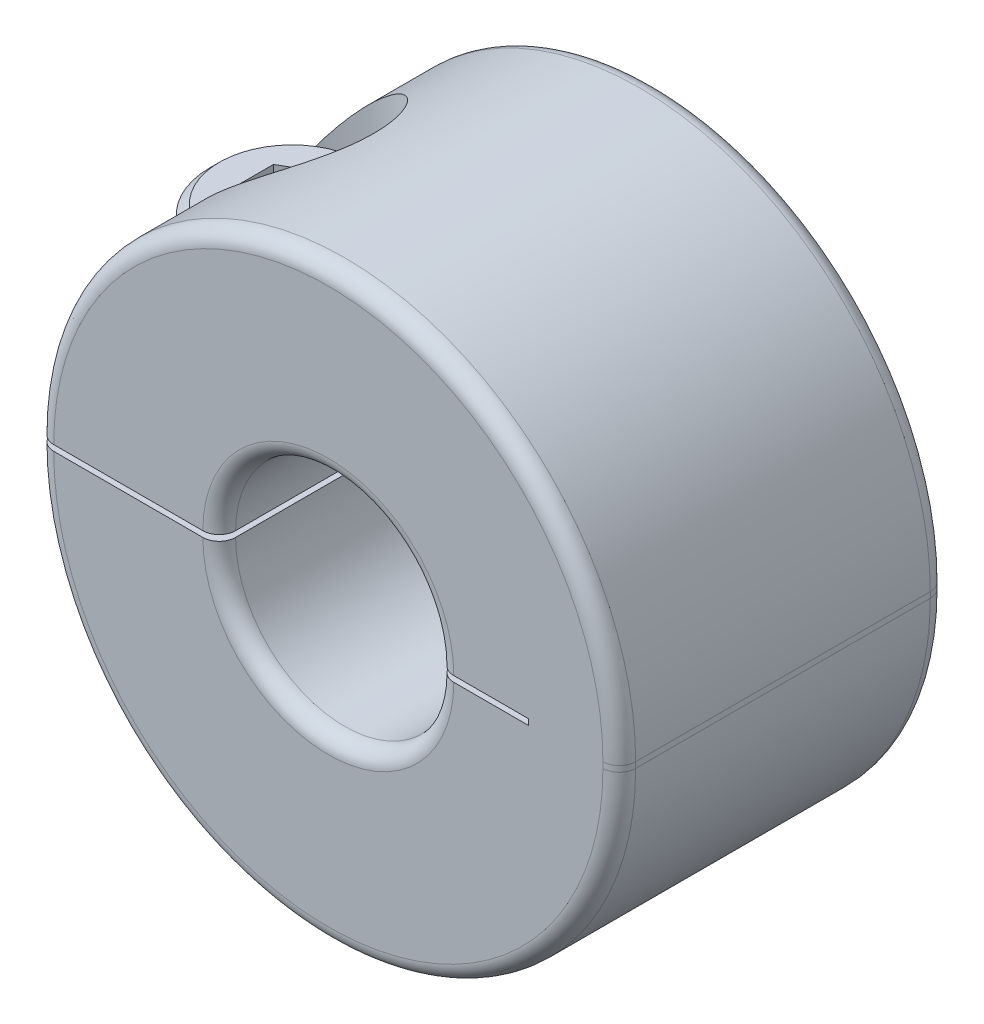
from build123d import *

# Parameters (mm, degrees)
EXTRUDE1_DEPTH     = 4.5
CUT_EXTRUDE2_DEPTH = 1.5
FILLET1_R          = 0.45
FILLET2_R          = 0.45
CHAMFER2_SIZE      = 0.254


with BuildPart() as part:
    # Sketch1 → Extrude1 (new, symmetric)
    with BuildSketch(Plane.XY):
        with BuildLine():
            Line((-8, 0.08), (-3, 0.08))
            ThreePointArc((-3, 0.08), (0, 3.08), (3, 0.08))
            Line((3, 0.08), (5.5, 0.08))
            Line((5.5, 0.08), (5.5, -0.08))
            Line((5.5, -0.08), (3, -0.08))
            ThreePointArc((3, -0.08), (0, -3.08), (-3, -0.08))
            Line((-3, -0.08), (-8, -0.08))
            ThreePointArc((-8, -0.08), (0, -8.08), (8, -0.08))
            Line((8, -0.08), (8, 0.08))
            ThreePointArc((8, 0.08), (0, 8.08), (-8, 0.08))
        make_face()
    extrude(amount=EXTRUDE1_DEPTH, both=True)

    # Sketch4 → Cut-Revolve1 (revolve, cut)
    with BuildSketch(Plane.XY):
        Polygon((-5.5, 8.08), (-3.25, 8.08), (-3.25, 1.58), (-4, 1.58), (-4, -8.08), (-5.5, -8.08), align=None)
    revolve(axis=Axis((-5.5, -8.08, 0), (0, 1, 0)), mode=Mode.SUBTRACT)

    # Fillet1
    fillet1_edges = [part.edges().sort_by_distance(p)[0] for p in [
        (0, 3.08, -4.5),
        (0, 3.08, 4.5),
        (0, 8.08, -4.5),
        (0, 8.08, 4.5),
        (0, -8.08, -4.5),
        (0, -8.08, 4.5),
        (8, 0, -4.5),
        (8, 0, 4.5),
    ]]
    fillet(fillet1_edges, radius=FILLET1_R)

    # Fillet2
    fillet2_edges = [part.edges().sort_by_distance(p)[0] for p in [
        (0, -3.08, -4.5),
        (0, -3.08, 4.5),
    ]]
    fillet(fillet2_edges, radius=FILLET2_R)


with BuildPart() as body_2:
    # Sketch6 → Revolve1 (revolve)
    with BuildSketch(Plane.XY):
        Polygon((-5.5, 4.58), (-3.25, 4.58), (-3.25, 1.58), (-4, 1.58), (-4, -4.42), (-5.5, -4.42), align=None)
    revolve(axis=Axis((-5.5, -4.42, 0), (0, 1, 0)))

    # Sketch7 → Cut-Extrude2 (cut)
    with BuildSketch(Plane(origin=(0, 4.58, 0), x_dir=(-1, 0, 0), z_dir=(0, 1, 0))):
        Polygon((5.5, -1.385640646), (6.7, -0.692820323), (6.7, 0.692820323), (5.5, 1.385640646), (4.3, 0.692820323), (4.3, -0.692820323), align=None)
    extrude(amount=-CUT_EXTRUDE2_DEPTH, mode=Mode.SUBTRACT)

    # Chamfer2
    chamfer2_edges = [body_2.edges().sort_by_distance(p)[0] for p in [
        (-7.75, 4.58, 0),
    ]]
    chamfer(chamfer2_edges, length=CHAMFER2_SIZE)


solid = Compound([part.part, body_2.part])
